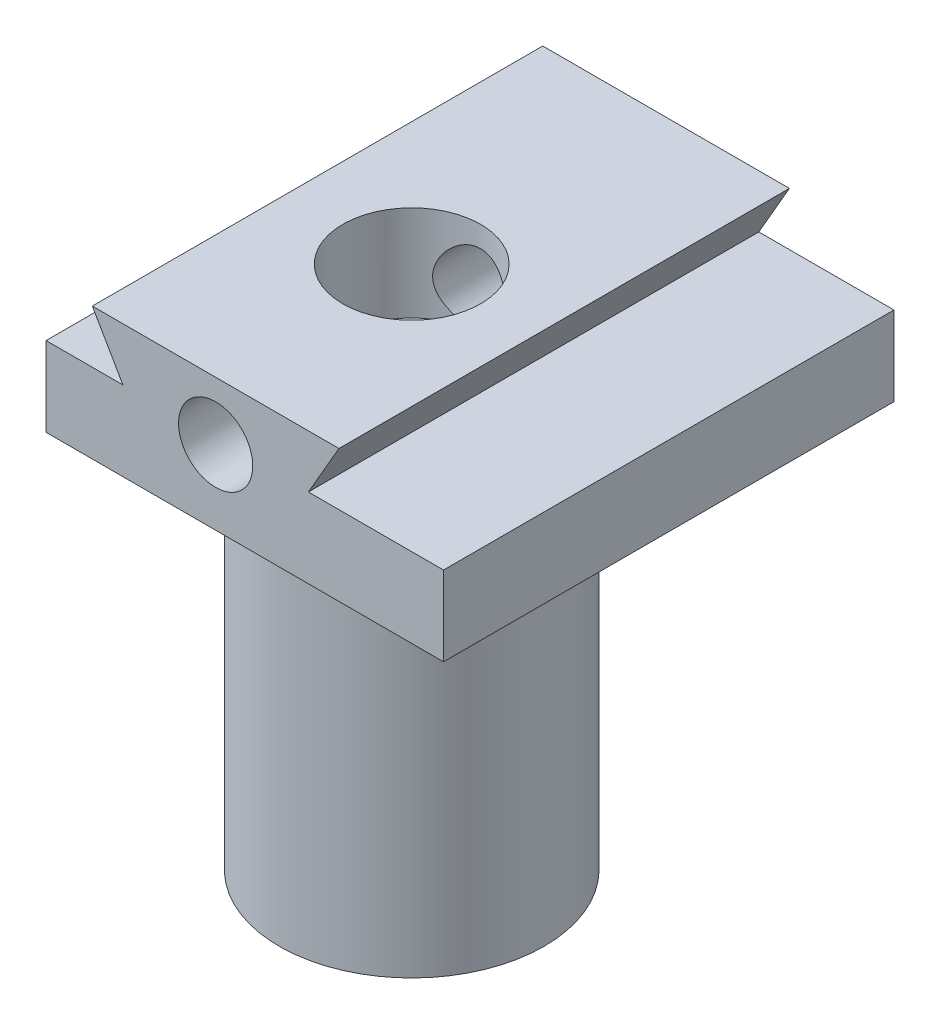
from build123d import *

# Parameters (mm, degrees)
SKETCH1_R           = 7
BOSS_EXTRUDE1_DEPTH = 85
SKETCH4_R           = 10
CUT_EXTRUDE1_DEPTH  = 85
SKETCH4_4_R         = 13
SKETCH4_4_R_2       = 10
CUT_EXTRUDE2_DEPTH  = 18
SKETCH5_R           = 25
SKETCH5_R_2         = 10
BOSS_EXTRUDE4_DEPTH = 74
SKETCH5_6_R         = 25
SKETCH5_6_R_2       = 22
CUT_EXTRUDE6_DEPTH  = 3
SKETCH7_R           = 22
CUT_EXTRUDE7_DEPTH  = 7
SKETCH8_R           = 3
CUT_EXTRUDE9_DEPTH  = 17
SKETCH8_4_R         = 3
CUT_EXTRUDE10_DEPTH = 6
SKETCH9_R           = 2.5
CUT_EXTRUDE12_DEPTH = 20


with BuildPart() as part:
    # Sketch1 → Boss-Extrude1 (new body)
    with BuildSketch(Plane.XY):
        Polygon((-130.604361384, 21.085427121), (-130.604361384, 36.085427121), (-116.104361384, 36.085427121), (-121.877864076, 46.085427121), (-75.330858693, 46.085427121), (-81.104361384, 36.085427121), (-55.604361384, 36.085427121), (-55.604361384, 21.085427121), (-71.579658114, 21.085427121), (-115.579658114, 21.085427121), align=None)
        with Locations((-98.604361384, 35.085427121)):
            Circle(SKETCH1_R, mode=Mode.SUBTRACT)
    extrude(amount=BOSS_EXTRUDE1_DEPTH)

    # Sketch4 → Cut-Extrude1 (cut)
    with BuildSketch(Plane(origin=(0, 46.085427121, 0), x_dir=(1, 0, 0), z_dir=(0, 1, 0))):
        with Locations((-98.604361384, -48)):
            Circle(SKETCH4_R)
    extrude(amount=-CUT_EXTRUDE1_DEPTH, mode=Mode.SUBTRACT)

    # Sketch4<4> → Cut-Extrude2 (cut)
    with BuildSketch(Plane(origin=(0, 46.085427121, 0), x_dir=(1, 0, 0), z_dir=(0, 1, 0))):
        with Locations((-98.604361384, -48)):
            Circle(SKETCH4_4_R)
        with Locations((-98.604361384, -48)):
            Circle(SKETCH4_4_R_2, mode=Mode.SUBTRACT)
    extrude(amount=-CUT_EXTRUDE2_DEPTH, mode=Mode.SUBTRACT)


with BuildPart() as body_2:
    # Sketch5 → Boss-Extrude4 (new body)
    with BuildSketch(Plane.XZ.offset(-21.085427121)):
        with Locations((-98.604361384, 48)):
            Circle(SKETCH5_R)
        with Locations((-98.604361384, 48)):
            Circle(SKETCH5_R_2, mode=Mode.SUBTRACT)
    extrude(amount=BOSS_EXTRUDE4_DEPTH)

    # Sketch5<6> → Cut-Extrude6 (cut)
    with BuildSketch(Plane.XZ.offset(-21.085427121)):
        with Locations((-98.604361384, 48)):
            Circle(SKETCH5_6_R)
        with Locations((-98.604361384, 48)):
            Circle(SKETCH5_6_R_2, mode=Mode.SUBTRACT)
    extrude(amount=CUT_EXTRUDE6_DEPTH, mode=Mode.SUBTRACT)

    # Sketch7 → Cut-Extrude7 (cut)
    with BuildSketch(Plane.XZ.offset(52.914572879)):
        with Locations((-98.604361384, 48)):
            Circle(SKETCH7_R)
    extrude(amount=-CUT_EXTRUDE7_DEPTH, mode=Mode.SUBTRACT)

    # Sketch8 → Cut-Extrude9 (cut)
    with BuildSketch(Plane.ZY.offset(123.604361384)):
        with Locations((48, -24.914572879)):
            Circle(SKETCH8_R)
        with Locations((48, 1.085427121)):
            Circle(SKETCH8_R)
    extrude(amount=-CUT_EXTRUDE9_DEPTH, mode=Mode.SUBTRACT)

    # Sketch8<4> → Cut-Extrude10 (cut)
    with BuildSketch(Plane.ZY.offset(123.604361384)):
        with BuildLine():
            ThreePointArc((41, -32.914572879), (48, -39.914572879), (55, -32.914572879))
            Line((55, -32.914572879), (55, 9.085427121))
            ThreePointArc((55, 9.085427121), (48, 16.085427121), (41, 9.085427121))
            Line((41, 9.085427121), (41, -32.914572879))
        make_face()
        with Locations((48, -24.914572879)):
            Circle(SKETCH8_4_R, mode=Mode.SUBTRACT)
        with Locations((48, 1.085427121)):
            Circle(SKETCH8_4_R, mode=Mode.SUBTRACT)
    extrude(amount=-CUT_EXTRUDE10_DEPTH, mode=Mode.SUBTRACT)

    # Sketch9 → Cut-Extrude12 (cut)
    with BuildSketch(Plane.XZ.offset(45.914572879)):
        with Locations((-107.79674954, 57.192388155)):
            Circle(SKETCH9_R)
        with Locations((-89.411973229, 57.192388155)):
            Circle(SKETCH9_R)
        with Locations((-89.411973229, 38.807611845)):
            Circle(SKETCH9_R)
        with Locations((-107.79674954, 38.807611845)):
            Circle(SKETCH9_R)
    extrude(amount=-CUT_EXTRUDE12_DEPTH, mode=Mode.SUBTRACT)


solid = Compound([part.part, body_2.part])
